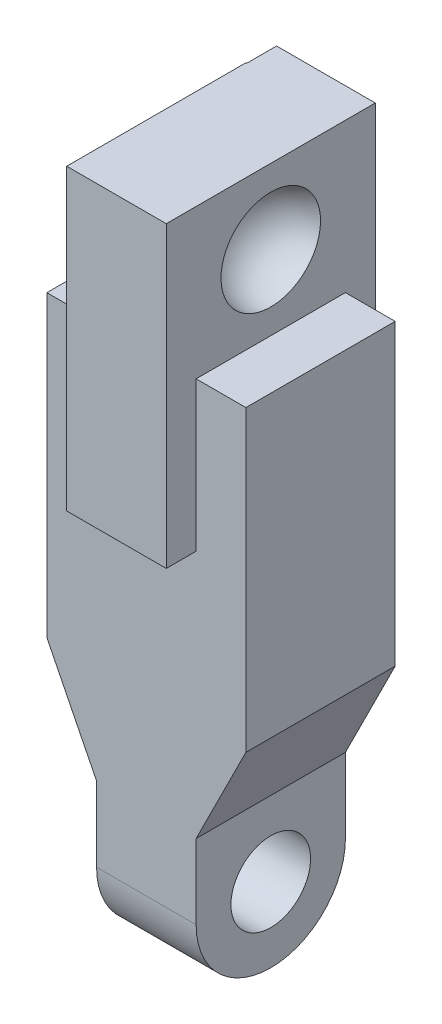
from build123d import *

# Parameters (mm, degrees)
SKETCH1_W            = 10
SKETCH1_H            = 30
BOSS_EXTRUDE1_DEPTH  = 15
BOSS_EXTRUDE5_DEPTH  = 15
SKETCH7_W            = 9.916734627
SKETCH7_H            = 30
BOSS_EXTRUDE7_DEPTH  = 3
SKETCH12_W           = 10
SKETCH12_H           = 15
BOSS_EXTRUDE9_DEPTH  = 15
SKETCH13_R           = 4
CUT_EXTRUDE3_DEPTH   = 15
FILLET2_R            = 7.5
SKETCH6_W            = 10
SKETCH6_H            = 30
BOSS_EXTRUDE11_DEPTH = 3


with BuildPart() as part:
    # Sketch1 → Boss-Extrude1 (new body)
    with BuildSketch(Plane.XY):
        with Locations((0.12195122, -8.922764228)):
            Rectangle(SKETCH1_W, SKETCH1_H)
    extrude(amount=BOSS_EXTRUDE1_DEPTH)

    # Sketch2 → Boss-Extrude5 (add)
    with BuildSketch(Plane.XY.offset(15)):
        Polygon((-4.87804878, -8.922764228), (-9.87804878, -8.922764228), (-9.87804878, -38.922764228), (-4.87804878, -48.922764228), (5.12195122, -48.922764228), (10.12195122, -38.922764228), (10.12195122, -8.922764228), (5.12195122, -8.922764228), (5.12195122, -23.922764228), (-4.87804878, -23.922764228), align=None)
    extrude(amount=-BOSS_EXTRUDE5_DEPTH)

    # Sketch7 → Boss-Extrude7 (add)
    with BuildSketch(Plane(origin=(0, 0, 0), x_dir=(-1, 0, 0), z_dir=(0, 0, -1))):
        with Locations((-0.163583906, -8.922764228)):
            Rectangle(SKETCH7_W, SKETCH7_H)
    extrude(amount=BOSS_EXTRUDE7_DEPTH)

    # Sketch12 → Boss-Extrude9 (add)
    with BuildSketch(Plane.XZ.offset(48.922764228)):
        with Locations((0.12195122, 7.5)):
            Rectangle(SKETCH12_W, SKETCH12_H)
    extrude(amount=BOSS_EXTRUDE9_DEPTH)

    # Sketch13 → Cut-Extrude3 (cut)
    with BuildSketch(Plane.ZY.offset(4.87804878)):
        with Locations((7.5, -56.422764228)):
            Circle(SKETCH13_R)
    extrude(amount=-CUT_EXTRUDE3_DEPTH, mode=Mode.SUBTRACT)

    # Fillet2
    fillet2_edges = [part.edges().sort_by_distance(p)[0] for p in [
        (0.12195122, -63.922764228, 0),
        (0.12195122, -63.922764228, 15),
    ]]
    fillet(fillet2_edges, radius=FILLET2_R - 0.0001)  # a hair under: the kernel refuses the full size

    # Sketch10 → Revolve3 (revolve)
    with BuildSketch(Plane.ZY.offset(4.87804878)):
        with BuildLine():
            Line((7.5, 3.577235772), (7.5, -6.422764228))
            ThreePointArc((7.5, -6.422764228), (2.5, -1.422764228), (7.5, 3.577235772))
        make_face()
    revolve(axis=Axis((-4.87804878, 3.577235772, 7.5), (0, -1, 0)))

    # Sketch15 → Cut-Revolve1 (revolve, cut)
    with BuildSketch(Plane(origin=(5.12195122, 0, 0), x_dir=(0, 0, -1), z_dir=(1, 0, 0))):
        with BuildLine():
            Line((-7.5, 3.577235772), (-7.5, -6.422764228))
            ThreePointArc((-7.5, -6.422764228), (-12.5, -1.422764228), (-7.5, 3.577235772))
        make_face()
    revolve(axis=Axis((5.12195122, 3.577235772, 7.5), (0, -1, 0)), mode=Mode.SUBTRACT)

    # Sketch6 → Boss-Extrude11 (add)
    with BuildSketch(Plane.XY.offset(15)):
        with Locations((0.12195122, -8.922764228)):
            Rectangle(SKETCH6_W, SKETCH6_H)
    extrude(amount=BOSS_EXTRUDE11_DEPTH)


solid = part.part
